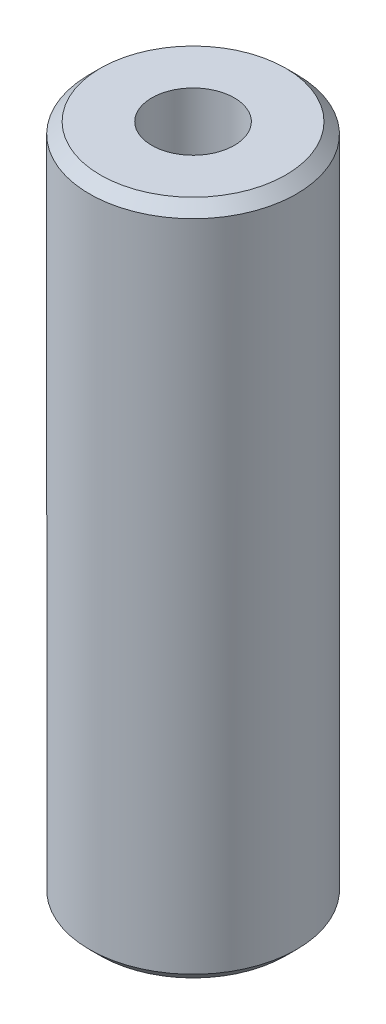
from build123d import *

# Parameters (mm, degrees)
SKETCH1_R           = 12.5
BOSS_EXTRUDE1_DEPTH = 81.641160801
SKETCH2_R           = 4.981161781
CUT_EXTRUDE1_DEPTH  = 84.533102043
CHAMFER1_SIZE       = 1.317985177


with BuildPart() as part:
    # Sketch1 → Boss-Extrude1 (new body)
    with BuildSketch(Plane(origin=(0, 0, 0), x_dir=(1, 0, 0), z_dir=(0, 1, 0))):
        Circle(SKETCH1_R)
    extrude(amount=BOSS_EXTRUDE1_DEPTH)

    # Sketch2 → Cut-Extrude1 (cut, through all)
    with BuildSketch(Plane(origin=(0, 0, 0), x_dir=(1, 0, 0), z_dir=(0, 1, 0))):
        Circle(SKETCH2_R)
    extrude(amount=CUT_EXTRUDE1_DEPTH, mode=Mode.SUBTRACT)

    # Chamfer1
    chamfer1_edges = [part.edges().sort_by_distance(p)[0] for p in [
        (-12.5, 81.641160801, 0),
        (-12.5, 0, 0),
    ]]
    chamfer(chamfer1_edges, length=CHAMFER1_SIZE)


solid = part.part
